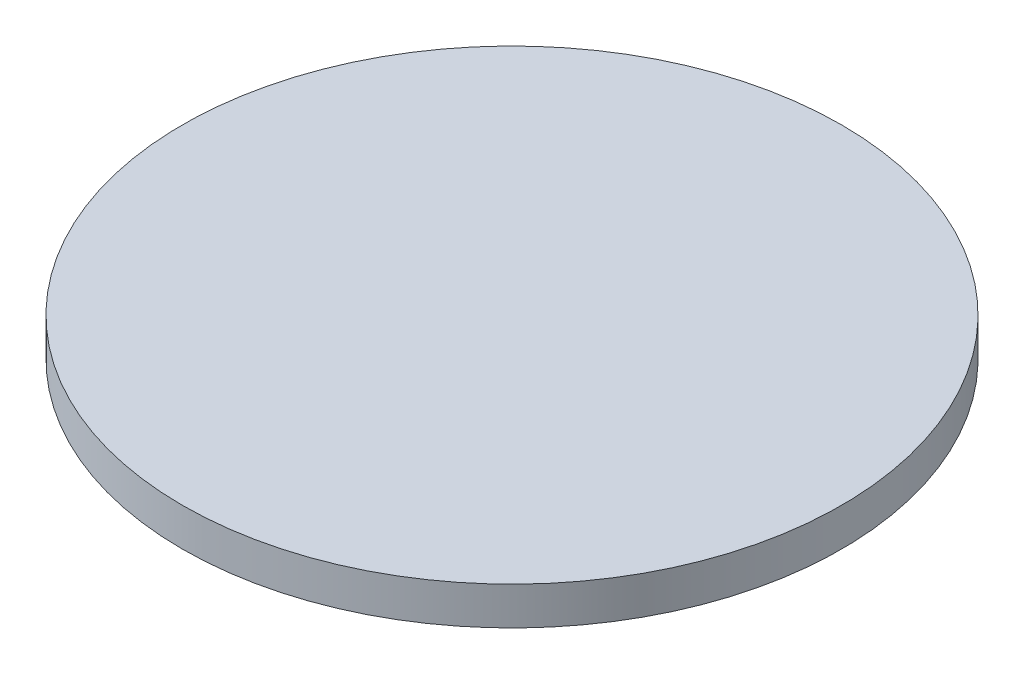
from build123d import *

# Parameters (mm, degrees)
SKETCH1_R           = 83.82
BOSS_EXTRUDE1_DEPTH = 4.826


with BuildPart() as part:
    # Sketch1 → Boss-Extrude1 (new, symmetric)
    with BuildSketch(Plane(origin=(0, 0, 0), x_dir=(1, 0, 0), z_dir=(0, 1, 0))):
        Circle(SKETCH1_R)
    extrude(amount=BOSS_EXTRUDE1_DEPTH, both=True)


solid = part.part
